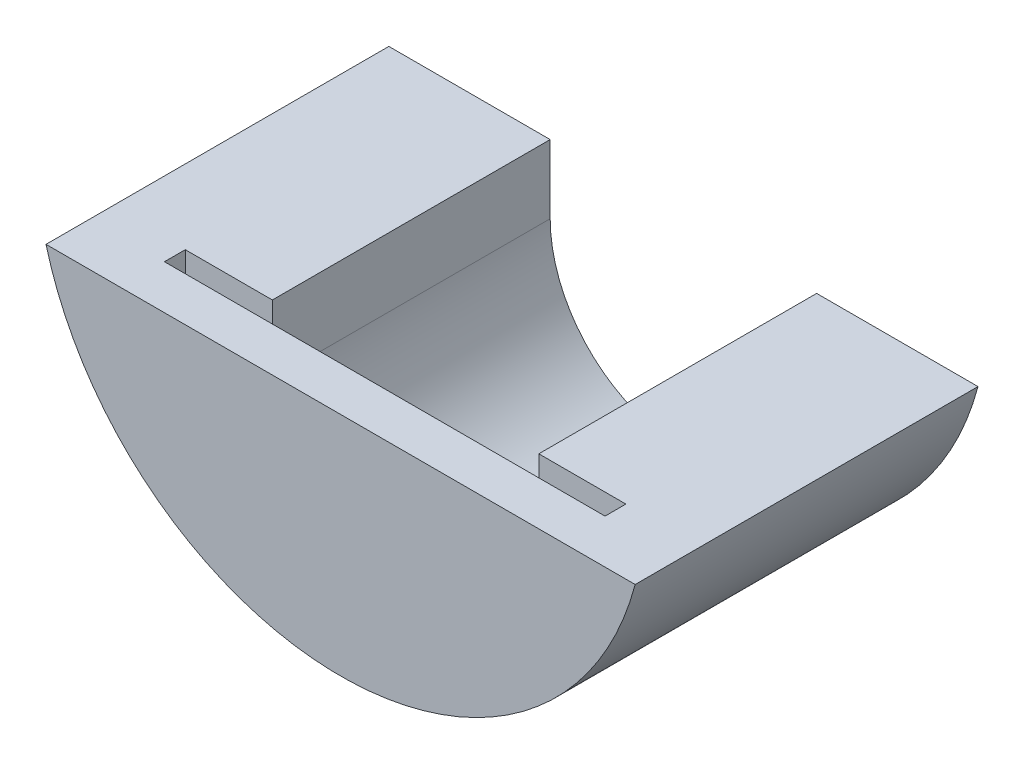
from build123d import *

# Parameters (mm, degrees)
BOSS_EXTRUDE1_DEPTH = 50
CAVITY1_DEPTH       = 42.56
CAVITY1_START       = 40.52
CAVITY1_2_DEPTH     = 2.04
CAVITY1_START_2     = 41.54
CAVITY1_3_DEPTH     = 1.02
CUT_EXTRUDE1_START  = -42.56
CUT_EXTRUDE1_DEPTH  = 42.56
CUT_EXTRUDE2_DEPTH  = 80.011407404
BOSS_EXTRUDE2_DEPTH = 10
CUT_EXTRUDE3_DEPTH  = 1
SKETCH7_W           = 6.44
SKETCH7_H           = 10
BOSS_EXTRUDE3_DEPTH = 38.862
BOSS_EXTRUDE4_DEPTH = 50


# Read off the part's stored shape, not the designer's step: Cavity1
with BuildPart() as part:
    # Sketch1 → Boss-Extrude1 (new body)
    with BuildSketch(Plane.XY):
        with BuildLine():
            Line((42.035699114, -14.45), (-42.035699114, -14.45))
            ThreePointArc((-42.035699114, -14.45), (0, -44.45), (42.035699114, -14.45))
        make_face()
    extrude(amount=BOSS_EXTRUDE1_DEPTH)

    # Cavity1 outline → Cavity1 (cut)
    with BuildSketch(Plane.XY):
        with BuildLine():
            ThreePointArc((-18.145557611, -14.45), (0, -40.831), (18.145557611, -14.45))
            Line((18.145557611, -14.45), (13.723350293, -14.45))
            ThreePointArc((13.723350293, -14.45), (0, -36.782875), (-13.723350293, -14.45))
            Line((-13.723350293, -14.45), (-18.145557611, -14.45))
        make_face()
    extrude(amount=CAVITY1_DEPTH, mode=Mode.SUBTRACT)

    # Cavity1 2 outline → Cavity1 2 (cut)
    with BuildSketch(Plane.XY.offset(CAVITY1_START)):
        with BuildLine():
            Line((30.602528867, -14.45), (18.145557611, -14.45))
            ThreePointArc((18.145557611, -14.45), (0, -40.831), (-18.145557611, -14.45))
            Line((-18.145557611, -14.45), (-30.602528867, -14.45))
            ThreePointArc((-30.602528867, -14.45), (-30.998341956, -27.419452985), (-21.93, -36.7))
            Line((-21.93, -36.7), (-6.816880824, -41.760107486))
            ThreePointArc((-6.816880824, -41.760107486), (0, -42.871), (6.816880824, -41.760107486))
            Line((6.816880824, -41.760107486), (21.93, -36.7))
            ThreePointArc((21.93, -36.7), (30.998341956, -27.419452985), (30.602528867, -14.45))
        make_face()
    extrude(amount=CAVITY1_2_DEPTH, mode=Mode.SUBTRACT)

    # Cavity1 3 outline → Cavity1 3 (cut)
    with BuildSketch(Plane.XY.offset(CAVITY1_START_2)):
        with BuildLine():
            ThreePointArc((-13.723350293, -14.45), (0, -36.782875), (13.723350293, -14.45))
            Line((13.723350293, -14.45), (7.578589464, -14.45))
            ThreePointArc((7.578589464, -14.45), (0, -31.682875), (-7.578589464, -14.45))
            Line((-7.578589464, -14.45), (-13.723350293, -14.45))
        make_face()
    extrude(amount=CAVITY1_3_DEPTH, mode=Mode.SUBTRACT)

    # Sketch2 → Cut-Extrude1 (cut)
    with BuildSketch(Plane(origin=(0, 0, 0), x_dir=(-1, 0, 0), z_dir=(0, 0, -1)).offset(CUT_EXTRUDE1_START)):
        with BuildLine():
            Line((13.723350293, -14.45), (-13.723350293, -14.45))
            ThreePointArc((-13.723350293, -14.45), (0, -36.782875), (13.723350293, -14.45))
        make_face()
    extrude(amount=CUT_EXTRUDE1_DEPTH, mode=Mode.SUBTRACT)

    # Sketch4 → Cut-Extrude2 (cut, through all)
    with BuildSketch(Plane(origin=(0, 0, 0), x_dir=(-1, 0, 0), z_dir=(0, 0, -1))):
        with BuildLine():
            ThreePointArc((-42.035699114, -14.45), (-40.646415857, -17.990869296), (-38.9594982, -21.4))
            Line((-38.9594982, -21.4), (-19.431, -21.4))
            ThreePointArc((-19.431, -21.4), (-19.106937103, -17.866062319), (-18.145557611, -14.45))
            Line((-18.145557611, -14.45), (-42.035699114, -14.45))
        make_face()
        with BuildLine():
            Line((19.431, -21.4), (38.9594982, -21.4))
            ThreePointArc((38.9594982, -21.4), (40.646415857, -17.990869296), (42.035699114, -14.45))
            Line((42.035699114, -14.45), (18.145557611, -14.45))
            ThreePointArc((18.145557611, -14.45), (19.106937103, -17.866062319), (19.431, -21.4))
        make_face()
    extrude(amount=-CUT_EXTRUDE2_DEPTH, mode=Mode.SUBTRACT)

    # Sketch5 → Boss-Extrude2 (add)
    with BuildSketch(Plane(origin=(0, -21.4, 0), x_dir=(1, 0, 0), z_dir=(0, 1, 0))):
        Polygon((-32.13, -42.56), (-32.13, -40.52), (-19.431, -40.52), (-19.431, 0), (-38.9594982, 0), (-38.9594982, -50), (-19.431, -50), (-19.431, -42.56), align=None)
        Polygon((19.431, -42.56), (19.431, -50), (38.9594982, -50), (38.9594982, 0), (19.431, 0), (19.431, -40.52), (32.13, -40.52), (32.13, -42.56), align=None)
    extrude(amount=BOSS_EXTRUDE2_DEPTH)

    # Sketch6 → Cut-Extrude3 (cut)
    with BuildSketch(Plane(origin=(0, 0, 42.56), x_dir=(-1, 0, 0), z_dir=(0, 0, -1))):
        with BuildLine():
            Line((-19.431, -21.4), (-19.431, -11.4))
            Line((-19.431, -11.4), (-32.13, -11.4))
            Line((-32.13, -11.4), (-32.13, -21.4))
            ThreePointArc((-32.13, -21.4), (-29.346233629, -30.594155752), (-21.93, -36.7))
            Line((-21.93, -36.7), (-6.816880824, -41.760107486))
            ThreePointArc((-6.816880824, -41.760107486), (0, -42.871), (6.816880824, -41.760107486))
            Line((6.816880824, -41.760107486), (21.93, -36.7))
            ThreePointArc((21.93, -36.7), (29.346233629, -30.594155752), (32.13, -21.4))
            Line((32.13, -21.4), (32.13, -11.4))
            Line((32.13, -11.4), (19.431, -11.4))
            Line((19.431, -11.4), (19.431, -21.4))
            ThreePointArc((19.431, -21.4), (19.106937103, -17.866062319), (18.145557611, -14.45))
            Line((18.145557611, -14.45), (-18.145557611, -14.45))
            ThreePointArc((-18.145557611, -14.45), (-19.106937103, -17.866062319), (-19.431, -21.4))
        make_face()
    extrude(amount=-CUT_EXTRUDE3_DEPTH, mode=Mode.SUBTRACT)

    # Sketch7 → Boss-Extrude3 (add)
    with BuildSketch(Plane.ZY.offset(-19.431)):
        with Locations((46.78, -16.4)):
            Rectangle(SKETCH7_W, SKETCH7_H)
    extrude(amount=BOSS_EXTRUDE3_DEPTH)

    # Sketch8 → Boss-Extrude4 (add, through all)
    with BuildSketch(Plane(origin=(0, 0, 0), x_dir=(-1, 0, 0), z_dir=(0, 0, -1))):
        with BuildLine():
            Line((-38.9594982, -21.4), (-38.9594982, -11.4))
            Line((-38.9594982, -11.4), (-42.963269196, -11.4))
            ThreePointArc((-42.963269196, -11.4), (-41.265420808, -16.521729496), (-38.9594982, -21.4))
        make_face()
        with BuildLine():
            Line((38.9594982, -11.4), (42.963269196, -11.4))
            ThreePointArc((42.963269196, -11.4), (41.265420808, -16.521729496), (38.9594982, -21.4))
            Line((38.9594982, -21.4), (38.9594982, -11.4))
        make_face()
    extrude(amount=-BOSS_EXTRUDE4_DEPTH)


solid = part.part
